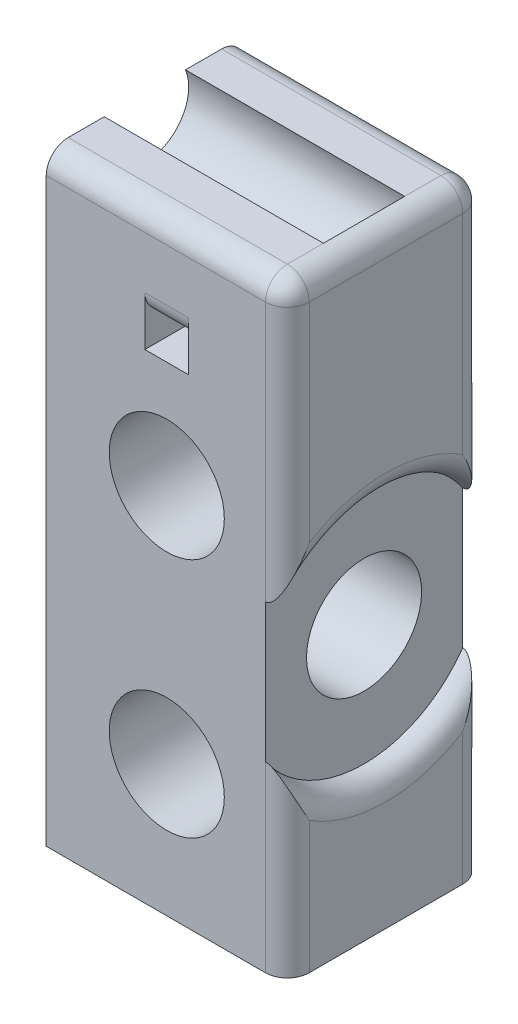
from build123d import *

# Parameters (mm, degrees)
SKETCH1_W           = 22
SKETCH1_H           = 55
SKETCH1_R           = 5.25
SKETCH1_W_2         = 4
SKETCH1_H_2         = 2.5
BOSS_EXTRUDE1_DEPTH = 18
SKETCH2_R           = 5.25
CUT_EXTRUDE1_DEPTH  = 62.911226769
SKETCH3_R           = 4
CUT_EXTRUDE2_DEPTH  = 20
SKETCH4_R           = 11
CUT_EXTRUDE3_DEPTH  = 2
FILLET3_R           = 2
FILLET2_R           = 2
FILLET4_R           = 2


# Some blends are built 0.0001 mm under size
with BuildPart() as part:
    # Sketch1 → Boss-Extrude1 (new body)
    with BuildSketch(Plane.XY):
        with Locations((11, 27.5)):
            Rectangle(SKETCH1_W, SKETCH1_H)
        with Locations((11, 12)):
            Circle(SKETCH1_R, mode=Mode.SUBTRACT)
        with Locations((11, 34)):
            Circle(SKETCH1_R, mode=Mode.SUBTRACT)
        with Locations((11, 45)):
            Rectangle(SKETCH1_W_2, SKETCH1_H_2, mode=Mode.SUBTRACT)
    extrude(amount=-BOSS_EXTRUDE1_DEPTH)

    # Sketch2 → Cut-Extrude1 (cut, through all)
    with BuildSketch(Plane.ZY):
        with Locations((-9, 23)):
            Circle(SKETCH2_R)
    extrude(amount=-CUT_EXTRUDE1_DEPTH, mode=Mode.SUBTRACT)

    # Sketch3 → Cut-Extrude2 (cut)
    with BuildSketch(Plane(origin=(0, 0, 0), x_dir=(0, 0, -1), z_dir=(1, 0, 0))):
        with Locations((9, 53.5)):
            Circle(SKETCH3_R)
    extrude(amount=CUT_EXTRUDE2_DEPTH, mode=Mode.SUBTRACT)

    # Sketch4 → Cut-Extrude3 (cut)
    with BuildSketch(Plane(origin=(22, 0, 0), x_dir=(0, 0, -1), z_dir=(1, 0, 0))):
        with Locations((9, 23)):
            Circle(SKETCH4_R)
    extrude(amount=-CUT_EXTRUDE3_DEPTH, mode=Mode.SUBTRACT)

    # Fillet3
    fillet3_edges = [part.edges().sort_by_distance(p)[0] for p in [
        (22, 12, -9),
        (22, 34, -9),
        (22, 8.33772234, -18),
        (22, 8.33772234, 0),
        (22, 42.16227766, -18),
        (22, 42.16227766, 0),
        (11, 55, -18),
        (11, 55, 0),
    ]]
    fillet(fillet3_edges, radius=FILLET3_R - 0.0001)  # a hair under: the kernel refuses the full size

    # Fillet2
    fillet2_edges = [part.edges().sort_by_distance(p)[0] for p in [
        (11, 46.25, -18),
        (11, 46.25, 0),
    ]]
    fillet(fillet2_edges, radius=FILLET2_R)

    # Fillet4
    # the kernel refuses this fillet: 2 mm, written as the material it takes off along each edge
    with BuildSketch(Plane(origin=(20, 53, -18), x_dir=(0, 1, 0), z_dir=(-1, 0, 0))) as fillet4_piece_1:
        with BuildLine():
            CenterArc((0.0001, -1.9999), 1.9999, 0, 90)
            Line((2, -1.9999), (2, 0))
            Line((2, 0), (0.0001, 0))
        make_face()
    revolve(axis=Axis((20, 53, -18), (0, 0, -1)), revolution_arc=90, mode=Mode.SUBTRACT)
    with BuildSketch(Plane(origin=(20, 53, 0), x_dir=(1, 0, 0), z_dir=(0, -1, 0))) as fillet4_piece_2:
        with BuildLine():
            CenterArc((0.0001, -1.9999), 1.9999, 0, 90)
            Line((2, -1.9999), (2, 0))
            Line((2, 0), (0.0001, 0))
        make_face()
    revolve(axis=Axis((20, 53, 0), (0, 0, 1)), revolution_arc=90, mode=Mode.SUBTRACT)
    with BuildSketch(Plane(origin=(22, 55, 0), x_dir=(0, -1, 0), z_dir=(0, 0, -1))) as fillet4_piece_3:
        with BuildLine():
            CenterArc((FILLET4_R, FILLET4_R), FILLET4_R, 180, 90)
            Line((0, FILLET4_R), (0, 0))
            Line((0, 0), (FILLET4_R, 0))
        make_face()
    extrude(amount=18, mode=Mode.SUBTRACT)


solid = part.part
